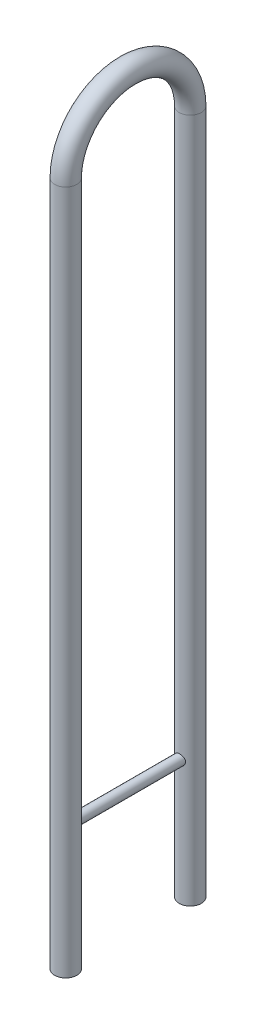
from build123d import *

# Parameters (mm, degrees)
SWEEP1_PROFILE_R = 13.589
SWEEP2_PROFILE_R = 6.35
SHELL1_T         = -1.524


with BuildPart() as part:
    # Sweep1: sweep along a path in Sketch2
    with BuildLine(Plane.YZ) as sweep1_path:
        Line((-838.2, 76.2), (0, 76.2))
        ThreePointArc((0, 76.2), (76.2, 0), (0, -76.2))
        Line((0, -76.2), (-838.2, -76.2))
    # Sweep1 profile (on start of the path) → Sweep1 (sweep)
    with BuildSketch(Plane(origin=(0, -838.2, 76.2), x_dir=(0, 0, 1), z_dir=(0, 1, 0))):
        Circle(SWEEP1_PROFILE_R)
    sweep(path=sweep1_path.line)

    # Sweep2: sweep along a path in Sketch2<3>
    with BuildLine(Plane.YZ) as sweep2_path:
        Line((-685.8, 76.2), (-685.8, -76.2))
    # Sweep2 profile (on start of the path) → Sweep2 (sweep)
    with BuildSketch(Plane(origin=(0, -685.8, 76.2), x_dir=(-1, 0, 0), z_dir=(0, 0, -1))):
        Circle(SWEEP2_PROFILE_R)
    sweep(path=sweep2_path.line)

    # Shell1
    shell1_openings = [part.faces().sort_by_distance(p)[0] for p in [
        (0, -838.2, -76.2),
        (0, -838.2, 76.2),
    ]]
    offset(amount=SHELL1_T, openings=shell1_openings, kind=Kind.INTERSECTION)


solid = part.part
